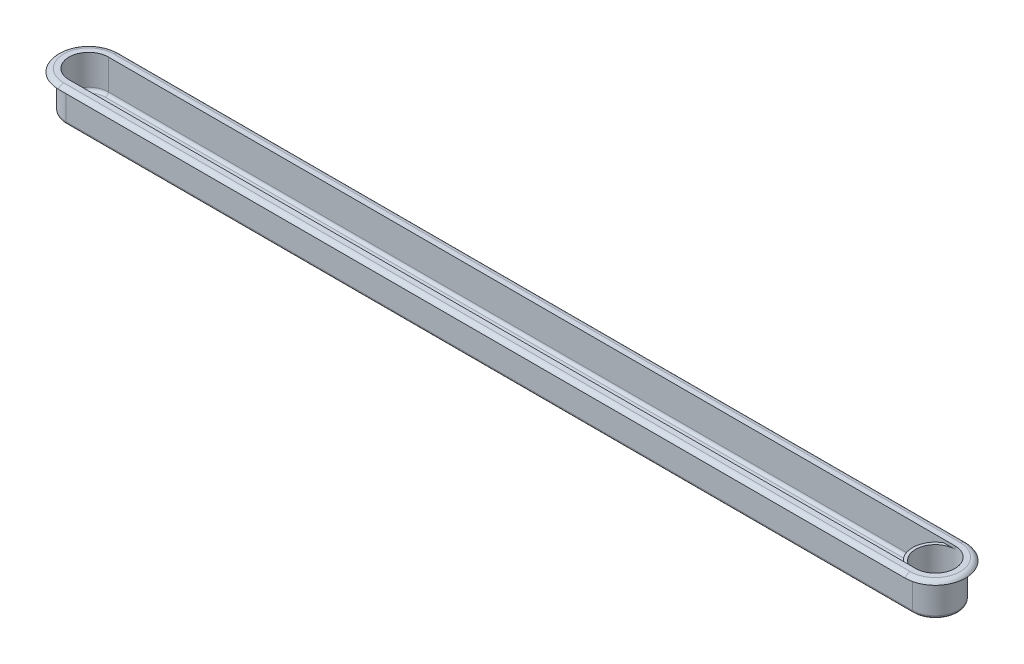
from build123d import *

# Parameters (mm, degrees)
BOSS_EXTRUDE1_DEPTH = 1.5
SKETCH2_R           = 6.5
BOSS_EXTRUDE2_DEPTH = 10
BOSS_EXTRUDE3_DEPTH = 1
FILLET1_R           = 2
FILLET2_R           = 1
FILLET3_R           = 1
CUT_EXTRUDE1_DEPTH  = 151.73486657
SKETCH5_R           = 0.75
CUT_EXTRUDE2_DEPTH  = 151.73486657


with BuildPart() as part:
    # Sketch1 → Boss-Extrude1 (new body)
    with BuildSketch(Plane(origin=(0, 0, 0), x_dir=(1, 0, 0), z_dir=(0, 1, 0))):
        with BuildLine():
            Line((140, 7.5), (-140, 7.5))
            ThreePointArc((-140, 7.5), (-147.5, 0), (-140, -7.5))
            Line((-140, -7.5), (140, -7.5))
            ThreePointArc((140, -7.5), (147.5, 0), (140, 7.5))
        make_face()
    extrude(amount=BOSS_EXTRUDE1_DEPTH)

    # Sketch2 → Boss-Extrude2 (add)
    with BuildSketch(Plane(origin=(0, 1.5, 0), x_dir=(1, 0, 0), z_dir=(0, 1, 0))):
        with BuildLine():
            Line((-140, -7.5), (140, -7.5))
            ThreePointArc((140, -7.5), (147.5, 0), (140, 7.5))
            Line((140, 7.5), (-140, 7.5))
            ThreePointArc((-140, 7.5), (-147.5, 0), (-140, -7.5))
        make_face()
        with Locations(Location((140, 0, 0), (0, 0, 270))):
            Circle(SKETCH2_R, mode=Mode.SUBTRACT)
        with BuildLine():
            Line((-140, 6.5), (136.258342613, 6.5))
            ThreePointArc((136.258342613, 6.5), (132.5, 0), (136.258342613, -6.5))
            Line((136.258342613, -6.5), (-140, -6.5))
            ThreePointArc((-140, -6.5), (-146.5, 0), (-140, 6.5))
        make_face(mode=Mode.SUBTRACT)
    extrude(amount=BOSS_EXTRUDE2_DEPTH)

    # Sketch3 → Boss-Extrude3 (add)
    with BuildSketch(Plane(origin=(0, 11.5, 0), x_dir=(1, 0, 0), z_dir=(0, 1, 0))):
        with BuildLine():
            Line((-140, 10), (140, 10))
            ThreePointArc((140, 10), (150, 0), (140, -10))
            Line((140, -10), (-140, -10))
            ThreePointArc((-140, -10), (-150, 0), (-140, 10))
        make_face()
        with BuildLine():
            Line((-140, -6.5), (136.258342613, -6.5))
            Line((136.258342613, -6.5), (140, -6.5))
            ThreePointArc((140, -6.5), (146.5, 0), (140, 6.5))
            Line((140, 6.5), (136.258342613, 6.5))
            Line((136.258342613, 6.5), (-140, 6.5))
            ThreePointArc((-140, 6.5), (-146.5, 0), (-140, -6.5))
        make_face(mode=Mode.SUBTRACT)
    extrude(amount=BOSS_EXTRUDE3_DEPTH)

    # Fillet1
    # the kernel refuses this fillet: 2 mm, written as the material it takes off along each edge
    with BuildSketch(Plane(origin=(-140, 12.5, 0), x_dir=(0, 0, 1), z_dir=(1, 0, 0))) as fillet1_piece_1:
        with BuildLine():
            CenterArc((8.267949192, 2), FILLET1_R, 270, 60)
            Line((10, 1), (10.034641016, 0.98))
            ThreePointArc((10.034641016, 0.98), (10.04, 0.5), (10.04, 0))
            Line((10.04, 0), (10, -0.04))
            Line((10, -0.04), (8.267949192, -0.04))
            Line((8.267949192, -0.04), (8.267949192, 0))
        make_face()
    revolve(axis=Axis((-140, 12.5, 0), (0, -1, 0)), revolution_arc=180, mode=Mode.SUBTRACT)
    with BuildSketch(Plane(origin=(140, 12.5, 10), x_dir=(0, -1, 0), z_dir=(-1, 0, 0))) as fillet1_piece_2:
        with BuildLine():
            CenterArc((2, -1.732050808), FILLET1_R, 120, 60)
            Line((0, -1.732050808), (-0.04, -1.732050808))
            Line((-0.04, -1.732050808), (-0.04, 0))
            Line((-0.04, 0), (0, 0.04))
            ThreePointArc((0, 0.04), (0.5, 0.04), (0.98, 0.034641016))
            Line((0.98, 0.034641016), (1, 0))
        make_face()
    extrude(amount=280, mode=Mode.SUBTRACT)
    with BuildSketch(Plane(origin=(140, 12.5, 0), x_dir=(0, 0, -1), z_dir=(-1, 0, 0))) as fillet1_piece_3:
        with BuildLine():
            CenterArc((8.267949192, 2), FILLET1_R, 270, 60)
            Line((10, 1), (10.034641016, 0.98))
            ThreePointArc((10.034641016, 0.98), (10.04, 0.5), (10.04, 0))
            Line((10.04, 0), (10, -0.04))
            Line((10, -0.04), (8.267949192, -0.04))
            Line((8.267949192, -0.04), (8.267949192, 0))
        make_face()
    revolve(axis=Axis((140, 12.5, 0), (0, -1, 0)), revolution_arc=180, mode=Mode.SUBTRACT)
    with BuildSketch(Plane(origin=(-140, 12.5, -10), x_dir=(0, 0, 1), z_dir=(1, 0, 0))) as fillet1_piece_4:
        with BuildLine():
            CenterArc((1.732050808, 2), FILLET1_R, 210, 60)
            Line((0, 1), (-0.034641016, 0.98))
            ThreePointArc((-0.034641016, 0.98), (-0.04, 0.5), (-0.04, 0))
            Line((-0.04, 0), (0, -0.04))
            Line((0, -0.04), (1.732050808, -0.04))
            Line((1.732050808, -0.04), (1.732050808, 0))
        make_face()
    extrude(amount=280, mode=Mode.SUBTRACT)

    # Fillet2
    fillet2_edges = [part.edges().sort_by_distance(p)[0] for p in [
        (0, 0, -7.5),
        (147.5, 0, 0),
        (0, 0, 7.5),
        (-147.5, 0, 0),
    ]]
    fillet(fillet2_edges, radius=FILLET2_R)

    # Fillet3
    fillet3_edges = [part.edges().sort_by_distance(p)[0] for p in [
        (-146.5, 1.5, 0),
        (-1.870828693, 1.5, 6.5),
        (-1.870828693, 1.5, -6.5),
    ]]
    fillet(fillet3_edges, radius=FILLET3_R)

    # Sketch4 → Cut-Extrude1 (cut, through all)
    with BuildSketch(Plane(origin=(0, 1.5, 0), x_dir=(1, 0, 0), z_dir=(0, 1, 0))):
        with BuildLine():
            Line((-123.5, 3.5), (-103.5, 3.5))
            ThreePointArc((-103.5, 3.5), (-100, 0), (-103.5, -3.5))
            Line((-103.5, -3.5), (-123.5, -3.5))
            ThreePointArc((-123.5, -3.5), (-127, 0), (-123.5, 3.5))
        make_face()
    extrude(amount=-CUT_EXTRUDE1_DEPTH, mode=Mode.SUBTRACT)

    # Sketch5 → Cut-Extrude2 (cut, through all)
    with BuildSketch(Plane(origin=(0, 1.5, 0), x_dir=(1, 0, 0), z_dir=(0, 1, 0))):
        with Locations(Location((140, 0, 0), (0, 0, 270))):
            Circle(SKETCH5_R)
    extrude(amount=-CUT_EXTRUDE2_DEPTH, mode=Mode.SUBTRACT)


solid = part.part
